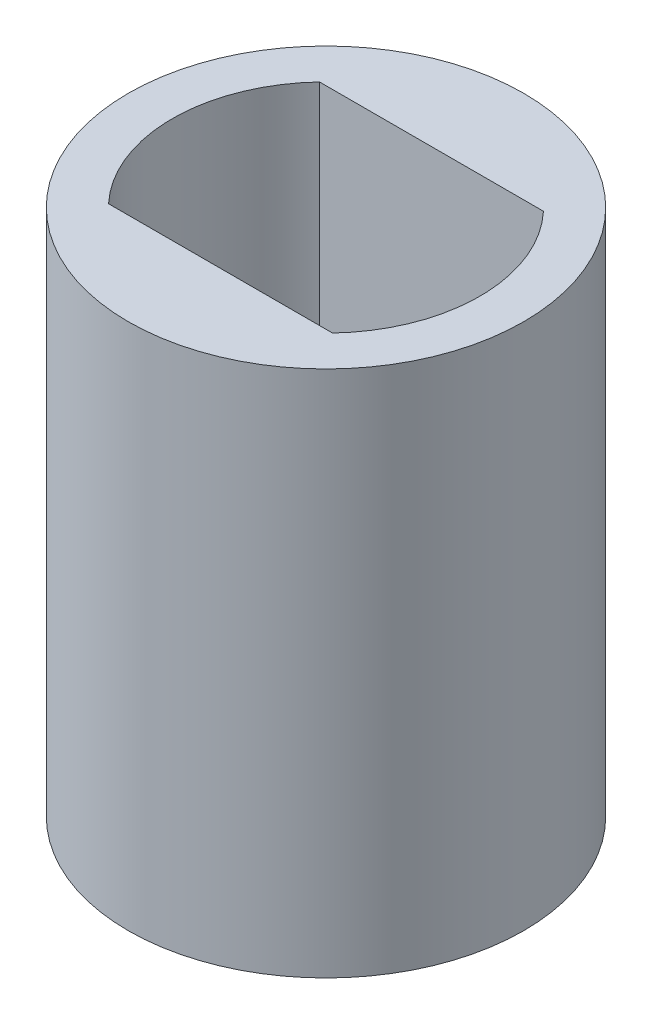
from build123d import *

# Parameters (mm, degrees)
EXTRUDE_START       = 3
SKETCH_1_R          = 4.5
EXTRUDE_1_DEPTH     = 12
CUT_EXTRUDE_3_DEPTH = 5
SKETCH_3_R          = 2.5
CUT_EXTRUDE_4_DEPTH = 7


with BuildPart() as part:
    # Эскиз1 → Вытянуть1 (new body)
    with BuildSketch(Plane(origin=(0, 0, 0), x_dir=(1, 0, 0), z_dir=(0, 1, 0)).offset(EXTRUDE_START)):
        Circle(SKETCH_1_R)
    extrude(amount=EXTRUDE_1_DEPTH)

    # Эскиз2 → Вытянуть3 (cut)
    with BuildSketch(Plane(origin=(0, 15, 0), x_dir=(1, 0, 0), z_dir=(0, 1, 0))):
        with BuildLine():
            Line((-2.547547841, 2.4), (2.547547841, 2.4))
            ThreePointArc((2.547547841, 2.4), (3.5, 0), (2.547547841, -2.4))
            Line((2.547547841, -2.4), (-2.547547841, -2.4))
            ThreePointArc((-2.547547841, -2.4), (-3.5, 0), (-2.547547841, 2.4))
        make_face()
    extrude(amount=-CUT_EXTRUDE_3_DEPTH, mode=Mode.SUBTRACT)

    # Эскиз3 → Вытянуть4 (cut)
    with BuildSketch(Plane.XZ.offset(-3)):
        Circle(SKETCH_3_R)
    extrude(amount=-CUT_EXTRUDE_4_DEPTH, mode=Mode.SUBTRACT)


solid = part.part
